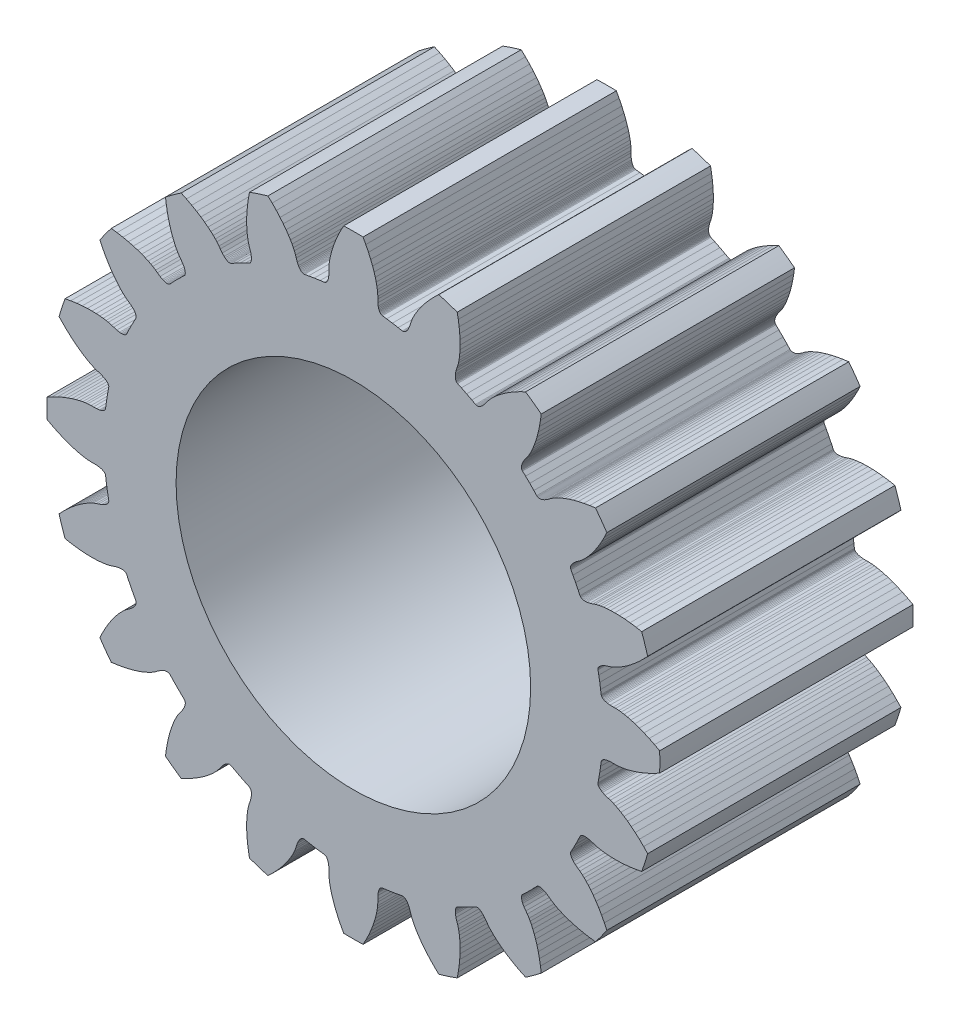
from build123d import *

# Parameters (mm, degrees)
MODEL_R             = 7
BOSS_EXTRUDE1_DEPTH = 10


with BuildPart() as part:
    # Model → Boss-Extrude1 (new body)
    with BuildSketch(Plane.XY):
        with BuildLine():
            Line((11.2915235, 3.0418739), (11.4619079, 3.2073958))
            Line((11.4619079, 3.2073958), (11.620070425, 3.373952203))
            ThreePointArc((11.620070425, 3.373952203), (11.507767436, 3.739100319), (11.383993824, 4.100521403))
            Line((11.383993824, 4.100521403), (11.1581382, 4.1423027))
            Line((11.1581382, 4.1423027), (10.923003, 4.1760633))
            Line((10.923003, 4.1760633), (10.7039175, 4.1982149))
            Line((10.7039175, 4.1982149), (10.502571, 4.2100898))
            Line((10.502571, 4.2100898), (10.3185985, 4.2132191))
            Line((10.3185985, 4.2132191), (10.1535493, 4.2091218))
            Line((10.1535493, 4.2091218), (10.0061288, 4.1992817))
            Line((10.0061288, 4.1992817), (9.8777646, 4.1853019))
            Line((9.8777646, 4.1853019), (9.7666137, 4.1684429))
            Line((9.7666137, 4.1684429), (9.676193, 4.1508334))
            Line((9.676193, 4.1508334), (9.5491158, 4.118138))
            Line((9.5491158, 4.118138), (9.462492, 4.0875699))
            Line((9.462492, 4.0875699), (9.3410531, 4.0503288))
            Line((9.3410531, 4.0503288), (9.2335928, 4.0297948))
            Line((9.2335928, 4.0297948), (9.1854733, 4.0254))
            Line((9.1854733, 4.0254), (9.1412703, 4.0247066))
            Line((9.1412703, 4.0247066), (9.1011235, 4.0275503))
            Line((9.1011235, 4.0275503), (9.0651686, 4.0337532))
            Line((9.0651686, 4.0337532), (9.0335098, 4.0431327))
            Line((9.0335098, 4.0431327), (9.0062735, 4.0555288))
            Line((9.0062735, 4.0555288), (8.9835686, 4.07075))
            Line((8.9835686, 4.07075), (8.9654902, 4.0886091))
            Line((8.9654902, 4.0886091), (8.9495613, 4.1143647))
            Line((8.9495613, 4.1143647), (8.8788891, 4.264785))
            Line((8.8788891, 4.264785), (8.7764143, 4.4718064))
            Line((8.7764143, 4.4718064), (8.6691636, 4.6763944))
            Line((8.6691636, 4.6763944), (8.5890111, 4.8219843))
            Line((8.5890111, 4.8219843), (8.5775372, 4.8500098))
            Line((8.5775372, 4.8500098), (8.573715, 4.8751328))
            Line((8.573715, 4.8751328), (8.5747465, 4.9024483))
            Line((8.5747465, 4.9024483), (8.5807269, 4.9317692))
            Line((8.5807269, 4.9317692), (8.5917473, 4.9628948))
            Line((8.5917473, 4.9628948), (8.6078628, 4.9956289))
            Line((8.6078628, 4.9956289), (8.6291599, 5.0297798))
            Line((8.6291599, 5.0297798), (8.6557027, 5.0651333))
            Line((8.6557027, 5.0651333), (8.6875421, 5.1014796))
            Line((8.6875421, 5.1014796), (8.767318, 5.1763472))
            Line((8.767318, 5.1763472), (8.8688268, 5.2527035))
            Line((8.8688268, 5.2527035), (8.9444731, 5.3048162))
            Line((8.9444731, 5.3048162), (9.0456183, 5.3884059))
            Line((9.0456183, 5.3884059), (9.1130126, 5.4512072))
            Line((9.1130126, 5.4512072), (9.1919847, 5.5312207))
            Line((9.1919847, 5.5312207), (9.2787452, 5.6268524))
            Line((9.2787452, 5.6268524), (9.3733576, 5.7403343))
            Line((9.3733576, 5.7403343), (9.4736858, 5.8714535))
            Line((9.4736858, 5.8714535), (9.5792905, 6.0221297))
            Line((9.5792905, 6.0221297), (9.688032, 6.1920024))
            Line((9.688032, 6.1920024), (9.7988862, 6.3822667))
            Line((9.7988862, 6.3822667), (9.9097824, 6.592339))
            Line((9.9097824, 6.592339), (10.008735211, 6.799618511))
            ThreePointArc((10.008735211, 6.799618511), (9.789091856, 7.112191578), (9.559690719, 7.417675202))
            Line((9.559690719, 7.417675202), (9.3319781, 7.3876183))
            Line((9.3319781, 7.3876183), (9.0979187, 7.3470657))
            Line((9.0979187, 7.3470657), (8.8827107, 7.300432))
            Line((8.8827107, 7.300432), (8.6875493, 7.2495062))
            Line((8.6875493, 7.2495062), (8.511614, 7.1956317))
            Line((8.511614, 7.1956317), (8.3559091, 7.140732))
            Line((8.3559091, 7.140732), (8.2187445, 7.0858181))
            Line((8.2187445, 7.0858181), (8.100983, 7.0328558))
            Line((8.100983, 7.0328558), (8.0004819, 6.9824744))
            Line((8.0004819, 6.9824744), (7.9199283, 6.9377853))
            Line((7.9199283, 6.9377853), (7.8091742, 6.8674211))
            Line((7.8091742, 6.8674211), (7.7362361, 6.8115808))
            Line((7.7362361, 6.8115808), (7.632249, 6.7386357))
            Line((7.632249, 6.7386357), (7.5363936, 6.6858997))
            Line((7.5363936, 6.6858997), (7.4919873, 6.6668502))
            Line((7.4919873, 6.6668502), (7.4501619, 6.6525313))
            Line((7.4501619, 6.6525313), (7.4111013, 6.6428298))
            Line((7.4111013, 6.6428298), (7.3749894, 6.6376184))
            Line((7.3749894, 6.6376184), (7.3419816, 6.6367558))
            Line((7.3419816, 6.6367558), (7.3122478, 6.6401287))
            Line((7.3122478, 6.6401287), (7.2859505, 6.6475886))
            Line((7.2859505, 6.6475886), (7.2632382, 6.6589872))
            Line((7.2632382, 6.6589872), (7.24013, 6.6785599))
            Line((7.24013, 6.6785599), (7.1264343, 6.7997792))
            Line((7.1264343, 6.7997792), (6.9650018, 6.9650018))
            Line((6.9650018, 6.9650018), (6.7997792, 7.1264343))
            Line((6.7997792, 7.1264343), (6.6785599, 7.24013))
            Line((6.6785599, 7.24013), (6.6589872, 7.2632382))
            Line((6.6589872, 7.2632382), (6.6475886, 7.2859505))
            Line((6.6475886, 7.2859505), (6.6401287, 7.3122478))
            Line((6.6401287, 7.3122478), (6.6367558, 7.3419816))
            Line((6.6367558, 7.3419816), (6.6376184, 7.3749894))
            Line((6.6376184, 7.3749894), (6.6428298, 7.4111013))
            Line((6.6428298, 7.4111013), (6.6525313, 7.4501619))
            Line((6.6525313, 7.4501619), (6.6668502, 7.4919873))
            Line((6.6668502, 7.4919873), (6.6858997, 7.5363936))
            Line((6.6858997, 7.5363936), (6.7386357, 7.632249))
            Line((6.7386357, 7.632249), (6.8115808, 7.7362361))
            Line((6.8115808, 7.7362361), (6.8674211, 7.8091742))
            Line((6.8674211, 7.8091742), (6.9377853, 7.9199283))
            Line((6.9377853, 7.9199283), (6.9824744, 8.0004819))
            Line((6.9824744, 8.0004819), (7.0328558, 8.100983))
            Line((7.0328558, 8.100983), (7.0858181, 8.2187445))
            Line((7.0858181, 8.2187445), (7.140732, 8.3559091))
            Line((7.140732, 8.3559091), (7.1956317, 8.511614))
            Line((7.1956317, 8.511614), (7.2495062, 8.6875493))
            Line((7.2495062, 8.6875493), (7.300432, 8.8827107))
            Line((7.300432, 8.8827107), (7.3470657, 9.0979187))
            Line((7.3470657, 9.0979187), (7.3876183, 9.3319781))
            Line((7.3876183, 9.3319781), (7.417675202, 9.559690719))
            ThreePointArc((7.417675202, 9.559690719), (7.112191666, 9.789091977), (6.799618511, 10.008735211))
            Line((6.799618511, 10.008735211), (6.592339, 9.9097824))
            Line((6.592339, 9.9097824), (6.3822667, 9.7988862))
            Line((6.3822667, 9.7988862), (6.1920024, 9.688032))
            Line((6.1920024, 9.688032), (6.0221297, 9.5792905))
            Line((6.0221297, 9.5792905), (5.8714535, 9.4736858))
            Line((5.8714535, 9.4736858), (5.7403343, 9.3733576))
            Line((5.7403343, 9.3733576), (5.6268524, 9.2787452))
            Line((5.6268524, 9.2787452), (5.5312207, 9.1919847))
            Line((5.5312207, 9.1919847), (5.4512072, 9.1130126))
            Line((5.4512072, 9.1130126), (5.3884059, 9.0456183))
            Line((5.3884059, 9.0456183), (5.3048162, 8.9444731))
            Line((5.3048162, 8.9444731), (5.2527035, 8.8688268))
            Line((5.2527035, 8.8688268), (5.1763472, 8.767318))
            Line((5.1763472, 8.767318), (5.1014796, 8.6875421))
            Line((5.1014796, 8.6875421), (5.0651333, 8.6557027))
            Line((5.0651333, 8.6557027), (5.0297798, 8.6291599))
            Line((5.0297798, 8.6291599), (4.9956289, 8.6078628))
            Line((4.9956289, 8.6078628), (4.9628948, 8.5917473))
            Line((4.9628948, 8.5917473), (4.9317692, 8.5807269))
            Line((4.9317692, 8.5807269), (4.9024483, 8.5747465))
            Line((4.9024483, 8.5747465), (4.8751328, 8.573715))
            Line((4.8751328, 8.573715), (4.8500098, 8.5775372))
            Line((4.8500098, 8.5775372), (4.8219843, 8.5890111))
            Line((4.8219843, 8.5890111), (4.6763944, 8.6691636))
            Line((4.6763944, 8.6691636), (4.4718064, 8.7764143))
            Line((4.4718064, 8.7764143), (4.264785, 8.8788891))
            Line((4.264785, 8.8788891), (4.1143647, 8.9495613))
            Line((4.1143647, 8.9495613), (4.0886091, 8.9654902))
            Line((4.0886091, 8.9654902), (4.07075, 8.9835686))
            Line((4.07075, 8.9835686), (4.0555288, 9.0062735))
            Line((4.0555288, 9.0062735), (4.0431327, 9.0335098))
            Line((4.0431327, 9.0335098), (4.0337532, 9.0651686))
            Line((4.0337532, 9.0651686), (4.0275503, 9.1011235))
            Line((4.0275503, 9.1011235), (4.0247066, 9.1412703))
            Line((4.0247066, 9.1412703), (4.0254, 9.1854733))
            Line((4.0254, 9.1854733), (4.0297948, 9.2335928))
            Line((4.0297948, 9.2335928), (4.0503288, 9.3410531))
            Line((4.0503288, 9.3410531), (4.0875699, 9.462492))
            Line((4.0875699, 9.462492), (4.118138, 9.5491158))
            Line((4.118138, 9.5491158), (4.1508334, 9.676193))
            Line((4.1508334, 9.676193), (4.1684429, 9.7666137))
            Line((4.1684429, 9.7666137), (4.1853019, 9.8777646))
            Line((4.1853019, 9.8777646), (4.1992817, 10.0061288))
            Line((4.1992817, 10.0061288), (4.2091218, 10.1535493))
            Line((4.2091218, 10.1535493), (4.2132191, 10.3185985))
            Line((4.2132191, 10.3185985), (4.2100898, 10.502571))
            Line((4.2100898, 10.502571), (4.1982149, 10.7039175))
            Line((4.1982149, 10.7039175), (4.1760633, 10.923003))
            Line((4.1760633, 10.923003), (4.1423027, 11.1581382))
            Line((4.1423027, 11.1581382), (4.100521403, 11.383993924))
            ThreePointArc((4.100521403, 11.383993924), (3.739100375, 11.507767709), (3.373952203, 11.620070525))
            Line((3.373952203, 11.620070525), (3.2073958, 11.4619079))
            Line((3.2073958, 11.4619079), (3.0418739, 11.2915235))
            Line((3.0418739, 11.2915235), (2.8951777, 11.1273))
            Line((2.8951777, 11.1273), (2.7672222, 10.9713871))
            Line((2.7672222, 10.9713871), (2.6565542, 10.8243896))
            Line((2.6565542, 10.8243896), (2.5628555, 10.6884537))
            Line((2.5628555, 10.6884537), (2.4841647, 10.5634041))
            Line((2.4841647, 10.5634041), (2.420024, 10.4513382))
            Line((2.420024, 10.4513382), (2.3683303, 10.3515057))
            Line((2.3683303, 10.3515057), (2.3294287, 10.2680032))
            Line((2.3294287, 10.2680032), (2.2811858, 10.1459777))
            Line((2.2811858, 10.1459777), (2.2549997, 10.0579301))
            Line((2.2549997, 10.0579301), (2.2137484, 9.9377942))
            Line((2.2137484, 9.9377942), (2.1671972, 9.8387875))
            Line((2.1671972, 9.8387875), (2.1424688, 9.7972748))
            Line((2.1424688, 9.7972748), (2.1170478, 9.7611062))
            Line((2.1170478, 9.7611062), (2.0911495, 9.7302983))
            Line((2.0911495, 9.7302983), (2.0649975, 9.7048561))
            Line((2.0649975, 9.7048561), (2.0388008, 9.6847567))
            Line((2.0388008, 9.6847567), (2.012763, 9.6700083))
            Line((2.012763, 9.6700083), (1.9871032, 9.6605864))
            Line((1.9871032, 9.6605864), (1.9620287, 9.6564581))
            Line((1.9620287, 9.6564581), (1.9318292, 9.6587101))
            Line((1.9318292, 9.6587101), (1.7685965, 9.6899499))
            Line((1.7685965, 9.6899499), (1.5408795, 9.7287302))
            Line((1.5408795, 9.7287302), (1.312324, 9.7622164))
            Line((1.312324, 9.7622164), (1.1474268, 9.7829472))
            Line((1.1474268, 9.7829472), (1.1180095, 9.7901376))
            Line((1.1180095, 9.7901376), (1.0954379, 9.8018123))
            Line((1.0954379, 9.8018123), (1.0739455, 9.8187024))
            Line((1.0739455, 9.8187024), (1.0537397, 9.8407751))
            Line((1.0537397, 9.8407751), (1.0350361, 9.867986))
            Line((1.0350361, 9.867986), (1.0180261, 9.9002643))
            Line((1.0180261, 9.9002643), (1.0029156, 9.9375674))
            Line((1.0029156, 9.9375674), (0.9899155, 9.9798213))
            Line((0.9899155, 9.9798213), (0.9792255, 10.0269437))
            Line((0.9792255, 10.0269437), (0.9655474, 10.1354898))
            Line((0.9655474, 10.1354898), (0.9634392, 10.2624932))
            Line((0.9634392, 10.2624932), (0.9657429, 10.3543234))
            Line((0.9657429, 10.3543234), (0.9575691, 10.4852844))
            Line((0.9575691, 10.4852844), (0.9463752, 10.5767213))
            Line((0.9463752, 10.5767213), (0.9280615, 10.6876418))
            Line((0.9280615, 10.6876418), (0.9016904, 10.8140434))
            Line((0.9016904, 10.8140434), (0.8654934, 10.9572894))
            Line((0.8654934, 10.9572894), (0.8183872, 11.1155266))
            Line((0.8183872, 11.1155266), (0.7585604, 11.2895278))
            Line((0.7585604, 11.2895278), (0.6850472, 11.4773502))
            Line((0.6850472, 11.4773502), (0.5962786, 11.6788677))
            Line((0.5962786, 11.6788677), (0.4915097, 11.892062))
            Line((0.4915097, 11.892062), (0.381980101, 12.093952308))
            ThreePointArc((0.381980101, 12.093952308), (5.3e-08, 12.0999831), (-0.381979995, 12.093952311))
            Line((-0.381979995, 12.093952311), (-0.4915097, 11.892062))
            Line((-0.4915097, 11.892062), (-0.5962786, 11.6788677))
            Line((-0.5962786, 11.6788677), (-0.6850472, 11.4773502))
            Line((-0.6850472, 11.4773502), (-0.7585604, 11.2895278))
            Line((-0.7585604, 11.2895278), (-0.8183872, 11.1155266))
            Line((-0.8183872, 11.1155266), (-0.8654934, 10.9572894))
            Line((-0.8654934, 10.9572894), (-0.9016904, 10.8140434))
            Line((-0.9016904, 10.8140434), (-0.9280615, 10.6876418))
            Line((-0.9280615, 10.6876418), (-0.9463752, 10.5767213))
            Line((-0.9463752, 10.5767213), (-0.9575691, 10.4852844))
            Line((-0.9575691, 10.4852844), (-0.9657429, 10.3543234))
            Line((-0.9657429, 10.3543234), (-0.9634392, 10.2624932))
            Line((-0.9634392, 10.2624932), (-0.9655474, 10.1354898))
            Line((-0.9655474, 10.1354898), (-0.9792255, 10.0269437))
            Line((-0.9792255, 10.0269437), (-0.9899155, 9.9798213))
            Line((-0.9899155, 9.9798213), (-1.0029156, 9.9375674))
            Line((-1.0029156, 9.9375674), (-1.0180261, 9.9002643))
            Line((-1.0180261, 9.9002643), (-1.0350361, 9.867986))
            Line((-1.0350361, 9.867986), (-1.0537397, 9.8407751))
            Line((-1.0537397, 9.8407751), (-1.0739455, 9.8187024))
            Line((-1.0739455, 9.8187024), (-1.0954379, 9.8018123))
            Line((-1.0954379, 9.8018123), (-1.1180095, 9.7901376))
            Line((-1.1180095, 9.7901376), (-1.1474268, 9.7829472))
            Line((-1.1474268, 9.7829472), (-1.312324, 9.7622164))
            Line((-1.312324, 9.7622164), (-1.5408795, 9.7287302))
            Line((-1.5408795, 9.7287302), (-1.7685965, 9.6899499))
            Line((-1.7685965, 9.6899499), (-1.9318292, 9.6587101))
            Line((-1.9318292, 9.6587101), (-1.9620287, 9.6564581))
            Line((-1.9620287, 9.6564581), (-1.9871032, 9.6605864))
            Line((-1.9871032, 9.6605864), (-2.012763, 9.6700083))
            Line((-2.012763, 9.6700083), (-2.0388008, 9.6847567))
            Line((-2.0388008, 9.6847567), (-2.0649975, 9.7048561))
            Line((-2.0649975, 9.7048561), (-2.0911495, 9.7302983))
            Line((-2.0911495, 9.7302983), (-2.1170478, 9.7611062))
            Line((-2.1170478, 9.7611062), (-2.1424688, 9.7972748))
            Line((-2.1424688, 9.7972748), (-2.1671972, 9.8387875))
            Line((-2.1671972, 9.8387875), (-2.2137484, 9.9377942))
            Line((-2.2137484, 9.9377942), (-2.2549997, 10.0579301))
            Line((-2.2549997, 10.0579301), (-2.2811858, 10.1459777))
            Line((-2.2811858, 10.1459777), (-2.3294287, 10.2680032))
            Line((-2.3294287, 10.2680032), (-2.3683303, 10.3515057))
            Line((-2.3683303, 10.3515057), (-2.420024, 10.4513382))
            Line((-2.420024, 10.4513382), (-2.4841647, 10.5634041))
            Line((-2.4841647, 10.5634041), (-2.5628555, 10.6884537))
            Line((-2.5628555, 10.6884537), (-2.6565542, 10.8243896))
            Line((-2.6565542, 10.8243896), (-2.7672222, 10.9713871))
            Line((-2.7672222, 10.9713871), (-2.8951777, 11.1273))
            Line((-2.8951777, 11.1273), (-3.0418739, 11.2915235))
            Line((-3.0418739, 11.2915235), (-3.2073958, 11.4619079))
            Line((-3.2073958, 11.4619079), (-3.373952203, 11.620070425))
            ThreePointArc((-3.373952203, 11.620070425), (-3.739100319, 11.507767436), (-4.100521403, 11.383993824))
            Line((-4.100521403, 11.383993824), (-4.1423027, 11.1581382))
            Line((-4.1423027, 11.1581382), (-4.1760633, 10.923003))
            Line((-4.1760633, 10.923003), (-4.1982149, 10.7039175))
            Line((-4.1982149, 10.7039175), (-4.2100898, 10.502571))
            Line((-4.2100898, 10.502571), (-4.2132191, 10.3185985))
            Line((-4.2132191, 10.3185985), (-4.2091218, 10.1535493))
            Line((-4.2091218, 10.1535493), (-4.1992817, 10.0061288))
            Line((-4.1992817, 10.0061288), (-4.1853019, 9.8777646))
            Line((-4.1853019, 9.8777646), (-4.1684429, 9.7666137))
            Line((-4.1684429, 9.7666137), (-4.1508334, 9.676193))
            Line((-4.1508334, 9.676193), (-4.118138, 9.5491158))
            Line((-4.118138, 9.5491158), (-4.0875699, 9.462492))
            Line((-4.0875699, 9.462492), (-4.0503288, 9.3410531))
            Line((-4.0503288, 9.3410531), (-4.0297948, 9.2335928))
            Line((-4.0297948, 9.2335928), (-4.0254, 9.1854733))
            Line((-4.0254, 9.1854733), (-4.0247066, 9.1412703))
            Line((-4.0247066, 9.1412703), (-4.0275503, 9.1011235))
            Line((-4.0275503, 9.1011235), (-4.0337532, 9.0651686))
            Line((-4.0337532, 9.0651686), (-4.0431327, 9.0335098))
            Line((-4.0431327, 9.0335098), (-4.0555288, 9.0062735))
            Line((-4.0555288, 9.0062735), (-4.07075, 8.9835686))
            Line((-4.07075, 8.9835686), (-4.0886091, 8.9654902))
            Line((-4.0886091, 8.9654902), (-4.1143647, 8.9495613))
            Line((-4.1143647, 8.9495613), (-4.264785, 8.8788891))
            Line((-4.264785, 8.8788891), (-4.4718064, 8.7764143))
            Line((-4.4718064, 8.7764143), (-4.6763944, 8.6691636))
            Line((-4.6763944, 8.6691636), (-4.8219843, 8.5890111))
            Line((-4.8219843, 8.5890111), (-4.8500098, 8.5775372))
            Line((-4.8500098, 8.5775372), (-4.8751328, 8.573715))
            Line((-4.8751328, 8.573715), (-4.9024483, 8.5747465))
            Line((-4.9024483, 8.5747465), (-4.9317692, 8.5807269))
            Line((-4.9317692, 8.5807269), (-4.9628948, 8.5917473))
            Line((-4.9628948, 8.5917473), (-4.9956289, 8.6078628))
            Line((-4.9956289, 8.6078628), (-5.0297798, 8.6291599))
            Line((-5.0297798, 8.6291599), (-5.0651333, 8.6557027))
            Line((-5.0651333, 8.6557027), (-5.1014796, 8.6875421))
            Line((-5.1014796, 8.6875421), (-5.1763472, 8.767318))
            Line((-5.1763472, 8.767318), (-5.2527035, 8.8688268))
            Line((-5.2527035, 8.8688268), (-5.3048162, 8.9444731))
            Line((-5.3048162, 8.9444731), (-5.3884059, 9.0456183))
            Line((-5.3884059, 9.0456183), (-5.4512072, 9.1130126))
            Line((-5.4512072, 9.1130126), (-5.5312207, 9.1919847))
            Line((-5.5312207, 9.1919847), (-5.6268524, 9.2787452))
            Line((-5.6268524, 9.2787452), (-5.7403343, 9.3733576))
            Line((-5.7403343, 9.3733576), (-5.8714535, 9.4736858))
            Line((-5.8714535, 9.4736858), (-6.0221297, 9.5792905))
            Line((-6.0221297, 9.5792905), (-6.1920024, 9.688032))
            Line((-6.1920024, 9.688032), (-6.3822667, 9.7988862))
            Line((-6.3822667, 9.7988862), (-6.592339, 9.9097824))
            Line((-6.592339, 9.9097824), (-6.799618511, 10.008735211))
            ThreePointArc((-6.799618511, 10.008735211), (-7.112191578, 9.789091856), (-7.417675202, 9.559690719))
            Line((-7.417675202, 9.559690719), (-7.3876183, 9.3319781))
            Line((-7.3876183, 9.3319781), (-7.3470657, 9.0979187))
            Line((-7.3470657, 9.0979187), (-7.300432, 8.8827107))
            Line((-7.300432, 8.8827107), (-7.2495062, 8.6875493))
            Line((-7.2495062, 8.6875493), (-7.1956317, 8.511614))
            Line((-7.1956317, 8.511614), (-7.140732, 8.3559091))
            Line((-7.140732, 8.3559091), (-7.0858181, 8.2187445))
            Line((-7.0858181, 8.2187445), (-7.0328558, 8.100983))
            Line((-7.0328558, 8.100983), (-6.9824744, 8.0004819))
            Line((-6.9824744, 8.0004819), (-6.9377853, 7.9199283))
            Line((-6.9377853, 7.9199283), (-6.8674211, 7.8091742))
            Line((-6.8674211, 7.8091742), (-6.8115808, 7.7362361))
            Line((-6.8115808, 7.7362361), (-6.7386357, 7.632249))
            Line((-6.7386357, 7.632249), (-6.6858997, 7.5363936))
            Line((-6.6858997, 7.5363936), (-6.6668502, 7.4919873))
            Line((-6.6668502, 7.4919873), (-6.6525313, 7.4501619))
            Line((-6.6525313, 7.4501619), (-6.6428298, 7.4111013))
            Line((-6.6428298, 7.4111013), (-6.6376184, 7.3749894))
            Line((-6.6376184, 7.3749894), (-6.6367558, 7.3419816))
            Line((-6.6367558, 7.3419816), (-6.6401287, 7.3122478))
            Line((-6.6401287, 7.3122478), (-6.6475886, 7.2859505))
            Line((-6.6475886, 7.2859505), (-6.6589872, 7.2632382))
            Line((-6.6589872, 7.2632382), (-6.6785599, 7.24013))
            Line((-6.6785599, 7.24013), (-6.7997792, 7.1264343))
            Line((-6.7997792, 7.1264343), (-6.9650018, 6.9650018))
            Line((-6.9650018, 6.9650018), (-7.1264343, 6.7997792))
            Line((-7.1264343, 6.7997792), (-7.24013, 6.6785599))
            Line((-7.24013, 6.6785599), (-7.2632382, 6.6589872))
            Line((-7.2632382, 6.6589872), (-7.2859505, 6.6475886))
            Line((-7.2859505, 6.6475886), (-7.3122478, 6.6401287))
            Line((-7.3122478, 6.6401287), (-7.3419816, 6.6367558))
            Line((-7.3419816, 6.6367558), (-7.3749894, 6.6376184))
            Line((-7.3749894, 6.6376184), (-7.4111013, 6.6428298))
            Line((-7.4111013, 6.6428298), (-7.4501619, 6.6525313))
            Line((-7.4501619, 6.6525313), (-7.4919873, 6.6668502))
            Line((-7.4919873, 6.6668502), (-7.5363936, 6.6858997))
            Line((-7.5363936, 6.6858997), (-7.632249, 6.7386357))
            Line((-7.632249, 6.7386357), (-7.7362361, 6.8115808))
            Line((-7.7362361, 6.8115808), (-7.8091742, 6.8674211))
            Line((-7.8091742, 6.8674211), (-7.9199283, 6.9377853))
            Line((-7.9199283, 6.9377853), (-8.0004819, 6.9824744))
            Line((-8.0004819, 6.9824744), (-8.100983, 7.0328558))
            Line((-8.100983, 7.0328558), (-8.2187445, 7.0858181))
            Line((-8.2187445, 7.0858181), (-8.3559091, 7.140732))
            Line((-8.3559091, 7.140732), (-8.511614, 7.1956317))
            Line((-8.511614, 7.1956317), (-8.6875493, 7.2495062))
            Line((-8.6875493, 7.2495062), (-8.8827107, 7.300432))
            Line((-8.8827107, 7.300432), (-9.0979187, 7.3470657))
            Line((-9.0979187, 7.3470657), (-9.3319781, 7.3876183))
            Line((-9.3319781, 7.3876183), (-9.559690719, 7.417675202))
            ThreePointArc((-9.559690719, 7.417675202), (-9.789091977, 7.112191666), (-10.008735211, 6.799618511))
            Line((-10.008735211, 6.799618511), (-9.9097824, 6.592339))
            Line((-9.9097824, 6.592339), (-9.7988862, 6.3822667))
            Line((-9.7988862, 6.3822667), (-9.688032, 6.1920024))
            Line((-9.688032, 6.1920024), (-9.5792905, 6.0221297))
            Line((-9.5792905, 6.0221297), (-9.4736858, 5.8714535))
            Line((-9.4736858, 5.8714535), (-9.3733576, 5.7403343))
            Line((-9.3733576, 5.7403343), (-9.2787452, 5.6268524))
            Line((-9.2787452, 5.6268524), (-9.1919847, 5.5312207))
            Line((-9.1919847, 5.5312207), (-9.1130126, 5.4512072))
            Line((-9.1130126, 5.4512072), (-9.0456183, 5.3884059))
            Line((-9.0456183, 5.3884059), (-8.9444731, 5.3048162))
            Line((-8.9444731, 5.3048162), (-8.8688268, 5.2527035))
            Line((-8.8688268, 5.2527035), (-8.767318, 5.1763472))
            Line((-8.767318, 5.1763472), (-8.6875421, 5.1014796))
            Line((-8.6875421, 5.1014796), (-8.6557027, 5.0651333))
            Line((-8.6557027, 5.0651333), (-8.6291599, 5.0297798))
            Line((-8.6291599, 5.0297798), (-8.6078628, 4.9956289))
            Line((-8.6078628, 4.9956289), (-8.5917473, 4.9628948))
            Line((-8.5917473, 4.9628948), (-8.5807269, 4.9317692))
            Line((-8.5807269, 4.9317692), (-8.5747465, 4.9024483))
            Line((-8.5747465, 4.9024483), (-8.573715, 4.8751328))
            Line((-8.573715, 4.8751328), (-8.5775372, 4.8500098))
            Line((-8.5775372, 4.8500098), (-8.5890111, 4.8219843))
            Line((-8.5890111, 4.8219843), (-8.6691636, 4.6763944))
            Line((-8.6691636, 4.6763944), (-8.7764143, 4.4718064))
            Line((-8.7764143, 4.4718064), (-8.8788891, 4.264785))
            Line((-8.8788891, 4.264785), (-8.9495613, 4.1143647))
            Line((-8.9495613, 4.1143647), (-8.9654902, 4.0886091))
            Line((-8.9654902, 4.0886091), (-8.9835686, 4.07075))
            Line((-8.9835686, 4.07075), (-9.0062735, 4.0555288))
            Line((-9.0062735, 4.0555288), (-9.0335098, 4.0431327))
            Line((-9.0335098, 4.0431327), (-9.0651686, 4.0337532))
            Line((-9.0651686, 4.0337532), (-9.1011235, 4.0275503))
            Line((-9.1011235, 4.0275503), (-9.1412703, 4.0247066))
            Line((-9.1412703, 4.0247066), (-9.1854733, 4.0254))
            Line((-9.1854733, 4.0254), (-9.2335928, 4.0297948))
            Line((-9.2335928, 4.0297948), (-9.3410531, 4.0503288))
            Line((-9.3410531, 4.0503288), (-9.462492, 4.0875699))
            Line((-9.462492, 4.0875699), (-9.5491158, 4.118138))
            Line((-9.5491158, 4.118138), (-9.676193, 4.1508334))
            Line((-9.676193, 4.1508334), (-9.7666137, 4.1684429))
            Line((-9.7666137, 4.1684429), (-9.8777646, 4.1853019))
            Line((-9.8777646, 4.1853019), (-10.0061288, 4.1992817))
            Line((-10.0061288, 4.1992817), (-10.1535493, 4.2091218))
            Line((-10.1535493, 4.2091218), (-10.3185985, 4.2132191))
            Line((-10.3185985, 4.2132191), (-10.502571, 4.2100898))
            Line((-10.502571, 4.2100898), (-10.7039175, 4.1982149))
            Line((-10.7039175, 4.1982149), (-10.923003, 4.1760633))
            Line((-10.923003, 4.1760633), (-11.1581382, 4.1423027))
            Line((-11.1581382, 4.1423027), (-11.383993924, 4.100521403))
            ThreePointArc((-11.383993924, 4.100521403), (-11.507767706, 3.739100374), (-11.620070525, 3.373952203))
            Line((-11.620070525, 3.373952203), (-11.4619079, 3.2073958))
            Line((-11.4619079, 3.2073958), (-11.2915235, 3.0418739))
            Line((-11.2915235, 3.0418739), (-11.1273, 2.8951777))
            Line((-11.1273, 2.8951777), (-10.9713871, 2.7672222))
            Line((-10.9713871, 2.7672222), (-10.8243896, 2.6565542))
            Line((-10.8243896, 2.6565542), (-10.6884537, 2.5628555))
            Line((-10.6884537, 2.5628555), (-10.5634041, 2.4841647))
            Line((-10.5634041, 2.4841647), (-10.4513382, 2.420024))
            Line((-10.4513382, 2.420024), (-10.3515057, 2.3683303))
            Line((-10.3515057, 2.3683303), (-10.2680032, 2.3294287))
            Line((-10.2680032, 2.3294287), (-10.1459777, 2.2811858))
            Line((-10.1459777, 2.2811858), (-10.0579301, 2.2549997))
            Line((-10.0579301, 2.2549997), (-9.9377942, 2.2137484))
            Line((-9.9377942, 2.2137484), (-9.8387875, 2.1671972))
            Line((-9.8387875, 2.1671972), (-9.7972748, 2.1424688))
            Line((-9.7972748, 2.1424688), (-9.7611062, 2.1170478))
            Line((-9.7611062, 2.1170478), (-9.7302983, 2.0911495))
            Line((-9.7302983, 2.0911495), (-9.7048561, 2.0649975))
            Line((-9.7048561, 2.0649975), (-9.6847567, 2.0388008))
            Line((-9.6847567, 2.0388008), (-9.6700083, 2.012763))
            Line((-9.6700083, 2.012763), (-9.6605864, 1.9871032))
            Line((-9.6605864, 1.9871032), (-9.6564581, 1.9620287))
            Line((-9.6564581, 1.9620287), (-9.6587101, 1.9318292))
            Line((-9.6587101, 1.9318292), (-9.6899499, 1.7685965))
            Line((-9.6899499, 1.7685965), (-9.7287302, 1.5408795))
            Line((-9.7287302, 1.5408795), (-9.7622164, 1.312324))
            Line((-9.7622164, 1.312324), (-9.7829472, 1.1474268))
            Line((-9.7829472, 1.1474268), (-9.7901376, 1.1180095))
            Line((-9.7901376, 1.1180095), (-9.8018123, 1.0954379))
            Line((-9.8018123, 1.0954379), (-9.8187024, 1.0739455))
            Line((-9.8187024, 1.0739455), (-9.8407751, 1.0537397))
            Line((-9.8407751, 1.0537397), (-9.867986, 1.0350361))
            Line((-9.867986, 1.0350361), (-9.9002643, 1.0180261))
            Line((-9.9002643, 1.0180261), (-9.9375674, 1.0029156))
            Line((-9.9375674, 1.0029156), (-9.9798213, 0.9899155))
            Line((-9.9798213, 0.9899155), (-10.0269437, 0.9792255))
            Line((-10.0269437, 0.9792255), (-10.1354898, 0.9655474))
            Line((-10.1354898, 0.9655474), (-10.2624932, 0.9634392))
            Line((-10.2624932, 0.9634392), (-10.3543234, 0.9657429))
            Line((-10.3543234, 0.9657429), (-10.4852844, 0.9575691))
            Line((-10.4852844, 0.9575691), (-10.5767213, 0.9463752))
            Line((-10.5767213, 0.9463752), (-10.6876418, 0.9280615))
            Line((-10.6876418, 0.9280615), (-10.8140434, 0.9016904))
            Line((-10.8140434, 0.9016904), (-10.9572894, 0.8654934))
            Line((-10.9572894, 0.8654934), (-11.1155266, 0.8183872))
            Line((-11.1155266, 0.8183872), (-11.2895278, 0.7585604))
            Line((-11.2895278, 0.7585604), (-11.4773502, 0.6850472))
            Line((-11.4773502, 0.6850472), (-11.6788677, 0.5962786))
            Line((-11.6788677, 0.5962786), (-11.892062, 0.4915097))
            Line((-11.892062, 0.4915097), (-12.093952311, 0.381980095))
            ThreePointArc((-12.093952311, 0.381980095), (-12.0999831, 4.7e-08), (-12.093952308, -0.381980001))
            Line((-12.093952308, -0.381980001), (-11.892062, -0.4915097))
            Line((-11.892062, -0.4915097), (-11.6788677, -0.5962786))
            Line((-11.6788677, -0.5962786), (-11.4773502, -0.6850472))
            Line((-11.4773502, -0.6850472), (-11.2895278, -0.7585604))
            Line((-11.2895278, -0.7585604), (-11.1155266, -0.8183872))
            Line((-11.1155266, -0.8183872), (-10.9572894, -0.8654934))
            Line((-10.9572894, -0.8654934), (-10.8140434, -0.9016904))
            Line((-10.8140434, -0.9016904), (-10.6876418, -0.9280615))
            Line((-10.6876418, -0.9280615), (-10.5767213, -0.9463752))
            Line((-10.5767213, -0.9463752), (-10.4852844, -0.9575691))
            Line((-10.4852844, -0.9575691), (-10.3543234, -0.9657429))
            Line((-10.3543234, -0.9657429), (-10.2624932, -0.9634392))
            Line((-10.2624932, -0.9634392), (-10.1354898, -0.9655474))
            Line((-10.1354898, -0.9655474), (-10.0269437, -0.9792255))
            Line((-10.0269437, -0.9792255), (-9.9798213, -0.9899155))
            Line((-9.9798213, -0.9899155), (-9.9375674, -1.0029156))
            Line((-9.9375674, -1.0029156), (-9.9002643, -1.0180261))
            Line((-9.9002643, -1.0180261), (-9.867986, -1.0350361))
            Line((-9.867986, -1.0350361), (-9.8407751, -1.0537397))
            Line((-9.8407751, -1.0537397), (-9.8187024, -1.0739455))
            Line((-9.8187024, -1.0739455), (-9.8018123, -1.0954379))
            Line((-9.8018123, -1.0954379), (-9.7901376, -1.1180095))
            Line((-9.7901376, -1.1180095), (-9.7829472, -1.1474268))
            Line((-9.7829472, -1.1474268), (-9.7622164, -1.312324))
            Line((-9.7622164, -1.312324), (-9.7287302, -1.5408795))
            Line((-9.7287302, -1.5408795), (-9.6899499, -1.7685965))
            Line((-9.6899499, -1.7685965), (-9.6587101, -1.9318292))
            Line((-9.6587101, -1.9318292), (-9.6564581, -1.9620287))
            Line((-9.6564581, -1.9620287), (-9.6605864, -1.9871032))
            Line((-9.6605864, -1.9871032), (-9.6700083, -2.012763))
            Line((-9.6700083, -2.012763), (-9.6847567, -2.0388008))
            Line((-9.6847567, -2.0388008), (-9.7048561, -2.0649975))
            Line((-9.7048561, -2.0649975), (-9.7302983, -2.0911495))
            Line((-9.7302983, -2.0911495), (-9.7611062, -2.1170478))
            Line((-9.7611062, -2.1170478), (-9.7972748, -2.1424688))
            Line((-9.7972748, -2.1424688), (-9.8387875, -2.1671972))
            Line((-9.8387875, -2.1671972), (-9.9377942, -2.2137484))
            Line((-9.9377942, -2.2137484), (-10.0579301, -2.2549997))
            Line((-10.0579301, -2.2549997), (-10.1459777, -2.2811858))
            Line((-10.1459777, -2.2811858), (-10.2680032, -2.3294287))
            Line((-10.2680032, -2.3294287), (-10.3515057, -2.3683303))
            Line((-10.3515057, -2.3683303), (-10.4513382, -2.420024))
            Line((-10.4513382, -2.420024), (-10.5634041, -2.4841647))
            Line((-10.5634041, -2.4841647), (-10.6884537, -2.5628555))
            Line((-10.6884537, -2.5628555), (-10.8243896, -2.6565542))
            Line((-10.8243896, -2.6565542), (-10.9713871, -2.7672222))
            Line((-10.9713871, -2.7672222), (-11.1273, -2.8951777))
            Line((-11.1273, -2.8951777), (-11.2915235, -3.0418739))
            Line((-11.2915235, -3.0418739), (-11.4619079, -3.2073958))
            Line((-11.4619079, -3.2073958), (-11.620070425, -3.373952203))
            ThreePointArc((-11.620070425, -3.373952203), (-11.507767436, -3.739100319), (-11.383993824, -4.100521403))
            Line((-11.383993824, -4.100521403), (-11.1581382, -4.1423027))
            Line((-11.1581382, -4.1423027), (-10.923003, -4.1760633))
            Line((-10.923003, -4.1760633), (-10.7039175, -4.1982149))
            Line((-10.7039175, -4.1982149), (-10.502571, -4.2100898))
            Line((-10.502571, -4.2100898), (-10.3185985, -4.2132191))
            Line((-10.3185985, -4.2132191), (-10.1535493, -4.2091218))
            Line((-10.1535493, -4.2091218), (-10.0061288, -4.1992817))
            Line((-10.0061288, -4.1992817), (-9.8777646, -4.1853019))
            Line((-9.8777646, -4.1853019), (-9.7666137, -4.1684429))
            Line((-9.7666137, -4.1684429), (-9.676193, -4.1508334))
            Line((-9.676193, -4.1508334), (-9.5491158, -4.118138))
            Line((-9.5491158, -4.118138), (-9.462492, -4.0875699))
            Line((-9.462492, -4.0875699), (-9.3410531, -4.0503288))
            Line((-9.3410531, -4.0503288), (-9.2335928, -4.0297948))
            Line((-9.2335928, -4.0297948), (-9.1854733, -4.0254))
            Line((-9.1854733, -4.0254), (-9.1412703, -4.0247066))
            Line((-9.1412703, -4.0247066), (-9.1011235, -4.0275503))
            Line((-9.1011235, -4.0275503), (-9.0651686, -4.0337532))
            Line((-9.0651686, -4.0337532), (-9.0335098, -4.0431327))
            Line((-9.0335098, -4.0431327), (-9.0062735, -4.0555288))
            Line((-9.0062735, -4.0555288), (-8.9835686, -4.07075))
            Line((-8.9835686, -4.07075), (-8.9654902, -4.0886091))
            Line((-8.9654902, -4.0886091), (-8.9495613, -4.1143647))
            Line((-8.9495613, -4.1143647), (-8.8788891, -4.264785))
            Line((-8.8788891, -4.264785), (-8.7764143, -4.4718064))
            Line((-8.7764143, -4.4718064), (-8.6691636, -4.6763944))
            Line((-8.6691636, -4.6763944), (-8.5890111, -4.8219843))
            Line((-8.5890111, -4.8219843), (-8.5775372, -4.8500098))
            Line((-8.5775372, -4.8500098), (-8.573715, -4.8751328))
            Line((-8.573715, -4.8751328), (-8.5747465, -4.9024483))
            Line((-8.5747465, -4.9024483), (-8.5807269, -4.9317692))
            Line((-8.5807269, -4.9317692), (-8.5917473, -4.9628948))
            Line((-8.5917473, -4.9628948), (-8.6078628, -4.9956289))
            Line((-8.6078628, -4.9956289), (-8.6291599, -5.0297798))
            Line((-8.6291599, -5.0297798), (-8.6557027, -5.0651333))
            Line((-8.6557027, -5.0651333), (-8.6875421, -5.1014796))
            Line((-8.6875421, -5.1014796), (-8.767318, -5.1763472))
            Line((-8.767318, -5.1763472), (-8.8688268, -5.2527035))
            Line((-8.8688268, -5.2527035), (-8.9444731, -5.3048162))
            Line((-8.9444731, -5.3048162), (-9.0456183, -5.3884059))
            Line((-9.0456183, -5.3884059), (-9.1130126, -5.4512072))
            Line((-9.1130126, -5.4512072), (-9.1919847, -5.5312207))
            Line((-9.1919847, -5.5312207), (-9.2787452, -5.6268524))
            Line((-9.2787452, -5.6268524), (-9.3733576, -5.7403343))
            Line((-9.3733576, -5.7403343), (-9.4736858, -5.8714535))
            Line((-9.4736858, -5.8714535), (-9.5792905, -6.0221297))
            Line((-9.5792905, -6.0221297), (-9.688032, -6.1920024))
            Line((-9.688032, -6.1920024), (-9.7988862, -6.3822667))
            Line((-9.7988862, -6.3822667), (-9.9097824, -6.592339))
            Line((-9.9097824, -6.592339), (-10.008735211, -6.799618511))
            ThreePointArc((-10.008735211, -6.799618511), (-9.789091856, -7.112191578), (-9.559690719, -7.417675202))
            Line((-9.559690719, -7.417675202), (-9.3319781, -7.3876183))
            Line((-9.3319781, -7.3876183), (-9.0979187, -7.3470657))
            Line((-9.0979187, -7.3470657), (-8.8827107, -7.300432))
            Line((-8.8827107, -7.300432), (-8.6875493, -7.2495062))
            Line((-8.6875493, -7.2495062), (-8.511614, -7.1956317))
            Line((-8.511614, -7.1956317), (-8.3559091, -7.140732))
            Line((-8.3559091, -7.140732), (-8.2187445, -7.0858181))
            Line((-8.2187445, -7.0858181), (-8.100983, -7.0328558))
            Line((-8.100983, -7.0328558), (-8.0004819, -6.9824744))
            Line((-8.0004819, -6.9824744), (-7.9199283, -6.9377853))
            Line((-7.9199283, -6.9377853), (-7.8091742, -6.8674211))
            Line((-7.8091742, -6.8674211), (-7.7362361, -6.8115808))
            Line((-7.7362361, -6.8115808), (-7.632249, -6.7386357))
            Line((-7.632249, -6.7386357), (-7.5363936, -6.6858997))
            Line((-7.5363936, -6.6858997), (-7.4919873, -6.6668502))
            Line((-7.4919873, -6.6668502), (-7.4501619, -6.6525313))
            Line((-7.4501619, -6.6525313), (-7.4111013, -6.6428298))
            Line((-7.4111013, -6.6428298), (-7.3749894, -6.6376184))
            Line((-7.3749894, -6.6376184), (-7.3419816, -6.6367558))
            Line((-7.3419816, -6.6367558), (-7.3122478, -6.6401287))
            Line((-7.3122478, -6.6401287), (-7.2859505, -6.6475886))
            Line((-7.2859505, -6.6475886), (-7.2632382, -6.6589872))
            Line((-7.2632382, -6.6589872), (-7.24013, -6.6785599))
            Line((-7.24013, -6.6785599), (-7.1264343, -6.7997792))
            Line((-7.1264343, -6.7997792), (-6.9650018, -6.9650018))
            Line((-6.9650018, -6.9650018), (-6.7997792, -7.1264343))
            Line((-6.7997792, -7.1264343), (-6.6785599, -7.24013))
            Line((-6.6785599, -7.24013), (-6.6589872, -7.2632382))
            Line((-6.6589872, -7.2632382), (-6.6475886, -7.2859505))
            Line((-6.6475886, -7.2859505), (-6.6401287, -7.3122478))
            Line((-6.6401287, -7.3122478), (-6.6367558, -7.3419816))
            Line((-6.6367558, -7.3419816), (-6.6376184, -7.3749894))
            Line((-6.6376184, -7.3749894), (-6.6428298, -7.4111013))
            Line((-6.6428298, -7.4111013), (-6.6525313, -7.4501619))
            Line((-6.6525313, -7.4501619), (-6.6668502, -7.4919873))
            Line((-6.6668502, -7.4919873), (-6.6858997, -7.5363936))
            Line((-6.6858997, -7.5363936), (-6.7386357, -7.632249))
            Line((-6.7386357, -7.632249), (-6.8115808, -7.7362361))
            Line((-6.8115808, -7.7362361), (-6.8674211, -7.8091742))
            Line((-6.8674211, -7.8091742), (-6.9377853, -7.9199283))
            Line((-6.9377853, -7.9199283), (-6.9824744, -8.0004819))
            Line((-6.9824744, -8.0004819), (-7.0328558, -8.100983))
            Line((-7.0328558, -8.100983), (-7.0858181, -8.2187445))
            Line((-7.0858181, -8.2187445), (-7.140732, -8.3559091))
            Line((-7.140732, -8.3559091), (-7.1956317, -8.511614))
            Line((-7.1956317, -8.511614), (-7.2495062, -8.6875493))
            Line((-7.2495062, -8.6875493), (-7.300432, -8.8827107))
            Line((-7.300432, -8.8827107), (-7.3470657, -9.0979187))
            Line((-7.3470657, -9.0979187), (-7.3876183, -9.3319781))
            Line((-7.3876183, -9.3319781), (-7.417675202, -9.559690719))
            ThreePointArc((-7.417675202, -9.559690719), (-7.112191666, -9.789091977), (-6.799618511, -10.008735211))
            Line((-6.799618511, -10.008735211), (-6.592339, -9.9097824))
            Line((-6.592339, -9.9097824), (-6.3822667, -9.7988862))
            Line((-6.3822667, -9.7988862), (-6.1920024, -9.688032))
            Line((-6.1920024, -9.688032), (-6.0221297, -9.5792905))
            Line((-6.0221297, -9.5792905), (-5.8714535, -9.4736858))
            Line((-5.8714535, -9.4736858), (-5.7403343, -9.3733576))
            Line((-5.7403343, -9.3733576), (-5.6268524, -9.2787452))
            Line((-5.6268524, -9.2787452), (-5.5312207, -9.1919847))
            Line((-5.5312207, -9.1919847), (-5.4512072, -9.1130126))
            Line((-5.4512072, -9.1130126), (-5.3884059, -9.0456183))
            Line((-5.3884059, -9.0456183), (-5.3048162, -8.9444731))
            Line((-5.3048162, -8.9444731), (-5.2527035, -8.8688268))
            Line((-5.2527035, -8.8688268), (-5.1763472, -8.767318))
            Line((-5.1763472, -8.767318), (-5.1014796, -8.6875421))
            Line((-5.1014796, -8.6875421), (-5.0651333, -8.6557027))
            Line((-5.0651333, -8.6557027), (-5.0297798, -8.6291599))
            Line((-5.0297798, -8.6291599), (-4.9956289, -8.6078628))
            Line((-4.9956289, -8.6078628), (-4.9628948, -8.5917473))
            Line((-4.9628948, -8.5917473), (-4.9317692, -8.5807269))
            Line((-4.9317692, -8.5807269), (-4.9024483, -8.5747465))
            Line((-4.9024483, -8.5747465), (-4.8751328, -8.573715))
            Line((-4.8751328, -8.573715), (-4.8500098, -8.5775372))
            Line((-4.8500098, -8.5775372), (-4.8219843, -8.5890111))
            Line((-4.8219843, -8.5890111), (-4.6763944, -8.6691636))
            Line((-4.6763944, -8.6691636), (-4.4718064, -8.7764143))
            Line((-4.4718064, -8.7764143), (-4.264785, -8.8788891))
            Line((-4.264785, -8.8788891), (-4.1143647, -8.9495613))
            Line((-4.1143647, -8.9495613), (-4.0886091, -8.9654902))
            Line((-4.0886091, -8.9654902), (-4.07075, -8.9835686))
            Line((-4.07075, -8.9835686), (-4.0555288, -9.0062735))
            Line((-4.0555288, -9.0062735), (-4.0431327, -9.0335098))
            Line((-4.0431327, -9.0335098), (-4.0337532, -9.0651686))
            Line((-4.0337532, -9.0651686), (-4.0275503, -9.1011235))
            Line((-4.0275503, -9.1011235), (-4.0247066, -9.1412703))
            Line((-4.0247066, -9.1412703), (-4.0254, -9.1854733))
            Line((-4.0254, -9.1854733), (-4.0297948, -9.2335928))
            Line((-4.0297948, -9.2335928), (-4.0503288, -9.3410531))
            Line((-4.0503288, -9.3410531), (-4.0875699, -9.462492))
            Line((-4.0875699, -9.462492), (-4.118138, -9.5491158))
            Line((-4.118138, -9.5491158), (-4.1508334, -9.676193))
            Line((-4.1508334, -9.676193), (-4.1684429, -9.7666137))
            Line((-4.1684429, -9.7666137), (-4.1853019, -9.8777646))
            Line((-4.1853019, -9.8777646), (-4.1992817, -10.0061288))
            Line((-4.1992817, -10.0061288), (-4.2091218, -10.1535493))
            Line((-4.2091218, -10.1535493), (-4.2132191, -10.3185985))
            Line((-4.2132191, -10.3185985), (-4.2100898, -10.502571))
            Line((-4.2100898, -10.502571), (-4.1982149, -10.7039175))
            Line((-4.1982149, -10.7039175), (-4.1760633, -10.923003))
            Line((-4.1760633, -10.923003), (-4.1423027, -11.1581382))
            Line((-4.1423027, -11.1581382), (-4.100521403, -11.383993924))
            ThreePointArc((-4.100521403, -11.383993924), (-3.739100374, -11.507767706), (-3.373952203, -11.620070525))
            Line((-3.373952203, -11.620070525), (-3.2073958, -11.4619079))
            Line((-3.2073958, -11.4619079), (-3.0418739, -11.2915235))
            Line((-3.0418739, -11.2915235), (-2.8951777, -11.1273))
            Line((-2.8951777, -11.1273), (-2.7672222, -10.9713871))
            Line((-2.7672222, -10.9713871), (-2.6565542, -10.8243896))
            Line((-2.6565542, -10.8243896), (-2.5628555, -10.6884537))
            Line((-2.5628555, -10.6884537), (-2.4841647, -10.5634041))
            Line((-2.4841647, -10.5634041), (-2.420024, -10.4513382))
            Line((-2.420024, -10.4513382), (-2.3683303, -10.3515057))
            Line((-2.3683303, -10.3515057), (-2.3294287, -10.2680032))
            Line((-2.3294287, -10.2680032), (-2.2811858, -10.1459777))
            Line((-2.2811858, -10.1459777), (-2.2549997, -10.0579301))
            Line((-2.2549997, -10.0579301), (-2.2137484, -9.9377942))
            Line((-2.2137484, -9.9377942), (-2.1671972, -9.8387875))
            Line((-2.1671972, -9.8387875), (-2.1424688, -9.7972748))
            Line((-2.1424688, -9.7972748), (-2.1170478, -9.7611062))
            Line((-2.1170478, -9.7611062), (-2.0911495, -9.7302983))
            Line((-2.0911495, -9.7302983), (-2.0649975, -9.7048561))
            Line((-2.0649975, -9.7048561), (-2.0388008, -9.6847567))
            Line((-2.0388008, -9.6847567), (-2.012763, -9.6700083))
            Line((-2.012763, -9.6700083), (-1.9871032, -9.6605864))
            Line((-1.9871032, -9.6605864), (-1.9620287, -9.6564581))
            Line((-1.9620287, -9.6564581), (-1.9318292, -9.6587101))
            Line((-1.9318292, -9.6587101), (-1.7685965, -9.6899499))
            Line((-1.7685965, -9.6899499), (-1.5408795, -9.7287302))
            Line((-1.5408795, -9.7287302), (-1.312324, -9.7622164))
            Line((-1.312324, -9.7622164), (-1.1474268, -9.7829472))
            Line((-1.1474268, -9.7829472), (-1.1180095, -9.7901376))
            Line((-1.1180095, -9.7901376), (-1.0954379, -9.8018123))
            Line((-1.0954379, -9.8018123), (-1.0739455, -9.8187024))
            Line((-1.0739455, -9.8187024), (-1.0537397, -9.8407751))
            Line((-1.0537397, -9.8407751), (-1.0350361, -9.867986))
            Line((-1.0350361, -9.867986), (-1.0180261, -9.9002643))
            Line((-1.0180261, -9.9002643), (-1.0029156, -9.9375674))
            Line((-1.0029156, -9.9375674), (-0.9899155, -9.9798213))
            Line((-0.9899155, -9.9798213), (-0.9792255, -10.0269437))
            Line((-0.9792255, -10.0269437), (-0.9655474, -10.1354898))
            Line((-0.9655474, -10.1354898), (-0.9634392, -10.2624932))
            Line((-0.9634392, -10.2624932), (-0.9657429, -10.3543234))
            Line((-0.9657429, -10.3543234), (-0.9575691, -10.4852844))
            Line((-0.9575691, -10.4852844), (-0.9463752, -10.5767213))
            Line((-0.9463752, -10.5767213), (-0.9280615, -10.6876418))
            Line((-0.9280615, -10.6876418), (-0.9016904, -10.8140434))
            Line((-0.9016904, -10.8140434), (-0.8654934, -10.9572894))
            Line((-0.8654934, -10.9572894), (-0.8183872, -11.1155266))
            Line((-0.8183872, -11.1155266), (-0.7585604, -11.2895278))
            Line((-0.7585604, -11.2895278), (-0.6850472, -11.4773502))
            Line((-0.6850472, -11.4773502), (-0.5962786, -11.6788677))
            Line((-0.5962786, -11.6788677), (-0.4915097, -11.892062))
            Line((-0.4915097, -11.892062), (-0.381980095, -12.093952311))
            ThreePointArc((-0.381980095, -12.093952311), (-4.7e-08, -12.0999831), (0.381980001, -12.093952308))
            Line((0.381980001, -12.093952308), (0.4915097, -11.892062))
            Line((0.4915097, -11.892062), (0.5962786, -11.6788677))
            Line((0.5962786, -11.6788677), (0.6850472, -11.4773502))
            Line((0.6850472, -11.4773502), (0.7585604, -11.2895278))
            Line((0.7585604, -11.2895278), (0.8183872, -11.1155266))
            Line((0.8183872, -11.1155266), (0.8654934, -10.9572894))
            Line((0.8654934, -10.9572894), (0.9016904, -10.8140434))
            Line((0.9016904, -10.8140434), (0.9280615, -10.6876418))
            Line((0.9280615, -10.6876418), (0.9463752, -10.5767213))
            Line((0.9463752, -10.5767213), (0.9575691, -10.4852844))
            Line((0.9575691, -10.4852844), (0.9657429, -10.3543234))
            Line((0.9657429, -10.3543234), (0.9634392, -10.2624932))
            Line((0.9634392, -10.2624932), (0.9655474, -10.1354898))
            Line((0.9655474, -10.1354898), (0.9792255, -10.0269437))
            Line((0.9792255, -10.0269437), (0.9899155, -9.9798213))
            Line((0.9899155, -9.9798213), (1.0029156, -9.9375674))
            Line((1.0029156, -9.9375674), (1.0180261, -9.9002643))
            Line((1.0180261, -9.9002643), (1.0350361, -9.867986))
            Line((1.0350361, -9.867986), (1.0537397, -9.8407751))
            Line((1.0537397, -9.8407751), (1.0739455, -9.8187024))
            Line((1.0739455, -9.8187024), (1.0954379, -9.8018123))
            Line((1.0954379, -9.8018123), (1.1180095, -9.7901376))
            Line((1.1180095, -9.7901376), (1.1474268, -9.7829472))
            Line((1.1474268, -9.7829472), (1.312324, -9.7622164))
            Line((1.312324, -9.7622164), (1.5408795, -9.7287302))
            Line((1.5408795, -9.7287302), (1.7685965, -9.6899499))
            Line((1.7685965, -9.6899499), (1.9318292, -9.6587101))
            Line((1.9318292, -9.6587101), (1.9620287, -9.6564581))
            Line((1.9620287, -9.6564581), (1.9871032, -9.6605864))
            Line((1.9871032, -9.6605864), (2.012763, -9.6700083))
            Line((2.012763, -9.6700083), (2.0388008, -9.6847567))
            Line((2.0388008, -9.6847567), (2.0649975, -9.7048561))
            Line((2.0649975, -9.7048561), (2.0911495, -9.7302983))
            Line((2.0911495, -9.7302983), (2.1170478, -9.7611062))
            Line((2.1170478, -9.7611062), (2.1424688, -9.7972748))
            Line((2.1424688, -9.7972748), (2.1671972, -9.8387875))
            Line((2.1671972, -9.8387875), (2.2137484, -9.9377942))
            Line((2.2137484, -9.9377942), (2.2549997, -10.0579301))
            Line((2.2549997, -10.0579301), (2.2811858, -10.1459777))
            Line((2.2811858, -10.1459777), (2.3294287, -10.2680032))
            Line((2.3294287, -10.2680032), (2.3683303, -10.3515057))
            Line((2.3683303, -10.3515057), (2.420024, -10.4513382))
            Line((2.420024, -10.4513382), (2.4841647, -10.5634041))
            Line((2.4841647, -10.5634041), (2.5628555, -10.6884537))
            Line((2.5628555, -10.6884537), (2.6565542, -10.8243896))
            Line((2.6565542, -10.8243896), (2.7672222, -10.9713871))
            Line((2.7672222, -10.9713871), (2.8951777, -11.1273))
            Line((2.8951777, -11.1273), (3.0418739, -11.2915235))
            Line((3.0418739, -11.2915235), (3.2073958, -11.4619079))
            Line((3.2073958, -11.4619079), (3.373952203, -11.620070425))
            ThreePointArc((3.373952203, -11.620070425), (3.739100319, -11.507767436), (4.100521403, -11.383993824))
            Line((4.100521403, -11.383993824), (4.1423027, -11.1581382))
            Line((4.1423027, -11.1581382), (4.1760633, -10.923003))
            Line((4.1760633, -10.923003), (4.1982149, -10.7039175))
            Line((4.1982149, -10.7039175), (4.2100898, -10.502571))
            Line((4.2100898, -10.502571), (4.2132191, -10.3185985))
            Line((4.2132191, -10.3185985), (4.2091218, -10.1535493))
            Line((4.2091218, -10.1535493), (4.1992817, -10.0061288))
            Line((4.1992817, -10.0061288), (4.1853019, -9.8777646))
            Line((4.1853019, -9.8777646), (4.1684429, -9.7666137))
            Line((4.1684429, -9.7666137), (4.1508334, -9.676193))
            Line((4.1508334, -9.676193), (4.118138, -9.5491158))
            Line((4.118138, -9.5491158), (4.0875699, -9.462492))
            Line((4.0875699, -9.462492), (4.0503288, -9.3410531))
            Line((4.0503288, -9.3410531), (4.0297948, -9.2335928))
            Line((4.0297948, -9.2335928), (4.0254, -9.1854733))
            Line((4.0254, -9.1854733), (4.0247066, -9.1412703))
            Line((4.0247066, -9.1412703), (4.0275503, -9.1011235))
            Line((4.0275503, -9.1011235), (4.0337532, -9.0651686))
            Line((4.0337532, -9.0651686), (4.0431327, -9.0335098))
            Line((4.0431327, -9.0335098), (4.0555288, -9.0062735))
            Line((4.0555288, -9.0062735), (4.07075, -8.9835686))
            Line((4.07075, -8.9835686), (4.0886091, -8.9654902))
            Line((4.0886091, -8.9654902), (4.1143647, -8.9495613))
            Line((4.1143647, -8.9495613), (4.264785, -8.8788891))
            Line((4.264785, -8.8788891), (4.4718064, -8.7764143))
            Line((4.4718064, -8.7764143), (4.6763944, -8.6691636))
            Line((4.6763944, -8.6691636), (4.8219843, -8.5890111))
            Line((4.8219843, -8.5890111), (4.8500098, -8.5775372))
            Line((4.8500098, -8.5775372), (4.8751328, -8.573715))
            Line((4.8751328, -8.573715), (4.9024483, -8.5747465))
            Line((4.9024483, -8.5747465), (4.9317692, -8.5807269))
            Line((4.9317692, -8.5807269), (4.9628948, -8.5917473))
            Line((4.9628948, -8.5917473), (4.9956289, -8.6078628))
            Line((4.9956289, -8.6078628), (5.0297798, -8.6291599))
            Line((5.0297798, -8.6291599), (5.0651333, -8.6557027))
            Line((5.0651333, -8.6557027), (5.1014796, -8.6875421))
            Line((5.1014796, -8.6875421), (5.1763472, -8.767318))
            Line((5.1763472, -8.767318), (5.2527035, -8.8688268))
            Line((5.2527035, -8.8688268), (5.3048162, -8.9444731))
            Line((5.3048162, -8.9444731), (5.3884059, -9.0456183))
            Line((5.3884059, -9.0456183), (5.4512072, -9.1130126))
            Line((5.4512072, -9.1130126), (5.5312207, -9.1919847))
            Line((5.5312207, -9.1919847), (5.6268524, -9.2787452))
            Line((5.6268524, -9.2787452), (5.7403343, -9.3733576))
            Line((5.7403343, -9.3733576), (5.8714535, -9.4736858))
            Line((5.8714535, -9.4736858), (6.0221297, -9.5792905))
            Line((6.0221297, -9.5792905), (6.1920024, -9.688032))
            Line((6.1920024, -9.688032), (6.3822667, -9.7988862))
            Line((6.3822667, -9.7988862), (6.592339, -9.9097824))
            Line((6.592339, -9.9097824), (6.799618511, -10.008735211))
            ThreePointArc((6.799618511, -10.008735211), (7.112191578, -9.789091856), (7.417675202, -9.559690719))
            Line((7.417675202, -9.559690719), (7.3876183, -9.3319781))
            Line((7.3876183, -9.3319781), (7.3470657, -9.0979187))
            Line((7.3470657, -9.0979187), (7.300432, -8.8827107))
            Line((7.300432, -8.8827107), (7.2495062, -8.6875493))
            Line((7.2495062, -8.6875493), (7.1956317, -8.511614))
            Line((7.1956317, -8.511614), (7.140732, -8.3559091))
            Line((7.140732, -8.3559091), (7.0858181, -8.2187445))
            Line((7.0858181, -8.2187445), (7.0328558, -8.100983))
            Line((7.0328558, -8.100983), (6.9824744, -8.0004819))
            Line((6.9824744, -8.0004819), (6.9377853, -7.9199283))
            Line((6.9377853, -7.9199283), (6.8674211, -7.8091742))
            Line((6.8674211, -7.8091742), (6.8115808, -7.7362361))
            Line((6.8115808, -7.7362361), (6.7386357, -7.632249))
            Line((6.7386357, -7.632249), (6.6858997, -7.5363936))
            Line((6.6858997, -7.5363936), (6.6668502, -7.4919873))
            Line((6.6668502, -7.4919873), (6.6525313, -7.4501619))
            Line((6.6525313, -7.4501619), (6.6428298, -7.4111013))
            Line((6.6428298, -7.4111013), (6.6376184, -7.3749894))
            Line((6.6376184, -7.3749894), (6.6367558, -7.3419816))
            Line((6.6367558, -7.3419816), (6.6401287, -7.3122478))
            Line((6.6401287, -7.3122478), (6.6475886, -7.2859505))
            Line((6.6475886, -7.2859505), (6.6589872, -7.2632382))
            Line((6.6589872, -7.2632382), (6.6785599, -7.24013))
            Line((6.6785599, -7.24013), (6.7997792, -7.1264343))
            Line((6.7997792, -7.1264343), (6.9650018, -6.9650018))
            Line((6.9650018, -6.9650018), (7.1264343, -6.7997792))
            Line((7.1264343, -6.7997792), (7.24013, -6.6785599))
            Line((7.24013, -6.6785599), (7.2632382, -6.6589872))
            Line((7.2632382, -6.6589872), (7.2859505, -6.6475886))
            Line((7.2859505, -6.6475886), (7.3122478, -6.6401287))
            Line((7.3122478, -6.6401287), (7.3419816, -6.6367558))
            Line((7.3419816, -6.6367558), (7.3749894, -6.6376184))
            Line((7.3749894, -6.6376184), (7.4111013, -6.6428298))
            Line((7.4111013, -6.6428298), (7.4501619, -6.6525313))
            Line((7.4501619, -6.6525313), (7.4919873, -6.6668502))
            Line((7.4919873, -6.6668502), (7.5363936, -6.6858997))
            Line((7.5363936, -6.6858997), (7.632249, -6.7386357))
            Line((7.632249, -6.7386357), (7.7362361, -6.8115808))
            Line((7.7362361, -6.8115808), (7.8091742, -6.8674211))
            Line((7.8091742, -6.8674211), (7.9199283, -6.9377853))
            Line((7.9199283, -6.9377853), (8.0004819, -6.9824744))
            Line((8.0004819, -6.9824744), (8.100983, -7.0328558))
            Line((8.100983, -7.0328558), (8.2187445, -7.0858181))
            Line((8.2187445, -7.0858181), (8.3559091, -7.140732))
            Line((8.3559091, -7.140732), (8.511614, -7.1956317))
            Line((8.511614, -7.1956317), (8.6875493, -7.2495062))
            Line((8.6875493, -7.2495062), (8.8827107, -7.300432))
            Line((8.8827107, -7.300432), (9.0979187, -7.3470657))
            Line((9.0979187, -7.3470657), (9.3319781, -7.3876183))
            Line((9.3319781, -7.3876183), (9.559690719, -7.417675202))
            ThreePointArc((9.559690719, -7.417675202), (9.789091977, -7.112191666), (10.008735211, -6.799618511))
            Line((10.008735211, -6.799618511), (9.9097824, -6.592339))
            Line((9.9097824, -6.592339), (9.7988862, -6.3822667))
            Line((9.7988862, -6.3822667), (9.688032, -6.1920024))
            Line((9.688032, -6.1920024), (9.5792905, -6.0221297))
            Line((9.5792905, -6.0221297), (9.4736858, -5.8714535))
            Line((9.4736858, -5.8714535), (9.3733576, -5.7403343))
            Line((9.3733576, -5.7403343), (9.2787452, -5.6268524))
            Line((9.2787452, -5.6268524), (9.1919847, -5.5312207))
            Line((9.1919847, -5.5312207), (9.1130126, -5.4512072))
            Line((9.1130126, -5.4512072), (9.0456183, -5.3884059))
            Line((9.0456183, -5.3884059), (8.9444731, -5.3048162))
            Line((8.9444731, -5.3048162), (8.8688268, -5.2527035))
            Line((8.8688268, -5.2527035), (8.767318, -5.1763472))
            Line((8.767318, -5.1763472), (8.6875421, -5.1014796))
            Line((8.6875421, -5.1014796), (8.6557027, -5.0651333))
            Line((8.6557027, -5.0651333), (8.6291599, -5.0297798))
            Line((8.6291599, -5.0297798), (8.6078628, -4.9956289))
            Line((8.6078628, -4.9956289), (8.5917473, -4.9628948))
            Line((8.5917473, -4.9628948), (8.5807269, -4.9317692))
            Line((8.5807269, -4.9317692), (8.5747465, -4.9024483))
            Line((8.5747465, -4.9024483), (8.573715, -4.8751328))
            Line((8.573715, -4.8751328), (8.5775372, -4.8500098))
            Line((8.5775372, -4.8500098), (8.5890111, -4.8219843))
            Line((8.5890111, -4.8219843), (8.6691636, -4.6763944))
            Line((8.6691636, -4.6763944), (8.7764143, -4.4718064))
            Line((8.7764143, -4.4718064), (8.8788891, -4.264785))
            Line((8.8788891, -4.264785), (8.9495613, -4.1143647))
            Line((8.9495613, -4.1143647), (8.9654902, -4.0886091))
            Line((8.9654902, -4.0886091), (8.9835686, -4.07075))
            Line((8.9835686, -4.07075), (9.0062735, -4.0555288))
            Line((9.0062735, -4.0555288), (9.0335098, -4.0431327))
            Line((9.0335098, -4.0431327), (9.0651686, -4.0337532))
            Line((9.0651686, -4.0337532), (9.1011235, -4.0275503))
            Line((9.1011235, -4.0275503), (9.1412703, -4.0247066))
            Line((9.1412703, -4.0247066), (9.1854733, -4.0254))
            Line((9.1854733, -4.0254), (9.2335928, -4.0297948))
            Line((9.2335928, -4.0297948), (9.3410531, -4.0503288))
            Line((9.3410531, -4.0503288), (9.462492, -4.0875699))
            Line((9.462492, -4.0875699), (9.5491158, -4.118138))
            Line((9.5491158, -4.118138), (9.676193, -4.1508334))
            Line((9.676193, -4.1508334), (9.7666137, -4.1684429))
            Line((9.7666137, -4.1684429), (9.8777646, -4.1853019))
            Line((9.8777646, -4.1853019), (10.0061288, -4.1992817))
            Line((10.0061288, -4.1992817), (10.1535493, -4.2091218))
            Line((10.1535493, -4.2091218), (10.3185985, -4.2132191))
            Line((10.3185985, -4.2132191), (10.502571, -4.2100898))
            Line((10.502571, -4.2100898), (10.7039175, -4.1982149))
            Line((10.7039175, -4.1982149), (10.923003, -4.1760633))
            Line((10.923003, -4.1760633), (11.1581382, -4.1423027))
            Line((11.1581382, -4.1423027), (11.383993924, -4.100521403))
            ThreePointArc((11.383993924, -4.100521403), (11.507767706, -3.739100374), (11.620070525, -3.373952203))
            Line((11.620070525, -3.373952203), (11.4619079, -3.2073958))
            Line((11.4619079, -3.2073958), (11.2915235, -3.0418739))
            Line((11.2915235, -3.0418739), (11.1273, -2.8951777))
            Line((11.1273, -2.8951777), (10.9713871, -2.7672222))
            Line((10.9713871, -2.7672222), (10.8243896, -2.6565542))
            Line((10.8243896, -2.6565542), (10.6884537, -2.5628555))
            Line((10.6884537, -2.5628555), (10.5634041, -2.4841647))
            Line((10.5634041, -2.4841647), (10.4513382, -2.420024))
            Line((10.4513382, -2.420024), (10.3515057, -2.3683303))
            Line((10.3515057, -2.3683303), (10.2680032, -2.3294287))
            Line((10.2680032, -2.3294287), (10.1459777, -2.2811858))
            Line((10.1459777, -2.2811858), (10.0579301, -2.2549997))
            Line((10.0579301, -2.2549997), (9.9377942, -2.2137484))
            Line((9.9377942, -2.2137484), (9.8387875, -2.1671972))
            Line((9.8387875, -2.1671972), (9.7972748, -2.1424688))
            Line((9.7972748, -2.1424688), (9.7611062, -2.1170478))
            Line((9.7611062, -2.1170478), (9.7302983, -2.0911495))
            Line((9.7302983, -2.0911495), (9.7048561, -2.0649975))
            Line((9.7048561, -2.0649975), (9.6847567, -2.0388008))
            Line((9.6847567, -2.0388008), (9.6700083, -2.012763))
            Line((9.6700083, -2.012763), (9.6605864, -1.9871032))
            Line((9.6605864, -1.9871032), (9.6564581, -1.9620287))
            Line((9.6564581, -1.9620287), (9.6587101, -1.9318292))
            Line((9.6587101, -1.9318292), (9.6899499, -1.7685965))
            Line((9.6899499, -1.7685965), (9.7287302, -1.5408795))
            Line((9.7287302, -1.5408795), (9.7622164, -1.312324))
            Line((9.7622164, -1.312324), (9.7829472, -1.1474268))
            Line((9.7829472, -1.1474268), (9.7901376, -1.1180095))
            Line((9.7901376, -1.1180095), (9.8018123, -1.0954379))
            Line((9.8018123, -1.0954379), (9.8187024, -1.0739455))
            Line((9.8187024, -1.0739455), (9.8407751, -1.0537397))
            Line((9.8407751, -1.0537397), (9.867986, -1.0350361))
            Line((9.867986, -1.0350361), (9.9002643, -1.0180261))
            Line((9.9002643, -1.0180261), (9.9375674, -1.0029156))
            Line((9.9375674, -1.0029156), (9.9798213, -0.9899155))
            Line((9.9798213, -0.9899155), (10.0269437, -0.9792255))
            Line((10.0269437, -0.9792255), (10.1354898, -0.9655474))
            Line((10.1354898, -0.9655474), (10.2624932, -0.9634392))
            Line((10.2624932, -0.9634392), (10.3543234, -0.9657429))
            Line((10.3543234, -0.9657429), (10.4852844, -0.9575691))
            Line((10.4852844, -0.9575691), (10.5767213, -0.9463752))
            Line((10.5767213, -0.9463752), (10.6876418, -0.9280615))
            Line((10.6876418, -0.9280615), (10.8140434, -0.9016904))
            Line((10.8140434, -0.9016904), (10.9572894, -0.8654934))
            Line((10.9572894, -0.8654934), (11.1155266, -0.8183872))
            Line((11.1155266, -0.8183872), (11.2895278, -0.7585604))
            Line((11.2895278, -0.7585604), (11.4773502, -0.6850472))
            Line((11.4773502, -0.6850472), (11.6788677, -0.5962786))
            Line((11.6788677, -0.5962786), (11.892062, -0.4915097))
            Line((11.892062, -0.4915097), (12.093952311, -0.381980095))
            ThreePointArc((12.093952311, -0.381980095), (12.0999831, -4.7e-08), (12.093952308, 0.381980001))
            Line((12.093952308, 0.381980001), (11.892062, 0.4915097))
            Line((11.892062, 0.4915097), (11.6788677, 0.5962786))
            Line((11.6788677, 0.5962786), (11.4773502, 0.6850472))
            Line((11.4773502, 0.6850472), (11.2895278, 0.7585604))
            Line((11.2895278, 0.7585604), (11.1155266, 0.8183872))
            Line((11.1155266, 0.8183872), (10.9572894, 0.8654934))
            Line((10.9572894, 0.8654934), (10.8140434, 0.9016904))
            Line((10.8140434, 0.9016904), (10.6876418, 0.9280615))
            Line((10.6876418, 0.9280615), (10.5767213, 0.9463752))
            Line((10.5767213, 0.9463752), (10.4852844, 0.9575691))
            Line((10.4852844, 0.9575691), (10.3543234, 0.9657429))
            Line((10.3543234, 0.9657429), (10.2624932, 0.9634392))
            Line((10.2624932, 0.9634392), (10.1354898, 0.9655474))
            Line((10.1354898, 0.9655474), (10.0269437, 0.9792255))
            Line((10.0269437, 0.9792255), (9.9798213, 0.9899155))
            Line((9.9798213, 0.9899155), (9.9375674, 1.0029156))
            Line((9.9375674, 1.0029156), (9.9002643, 1.0180261))
            Line((9.9002643, 1.0180261), (9.867986, 1.0350361))
            Line((9.867986, 1.0350361), (9.8407751, 1.0537397))
            Line((9.8407751, 1.0537397), (9.8187024, 1.0739455))
            Line((9.8187024, 1.0739455), (9.8018123, 1.0954379))
            Line((9.8018123, 1.0954379), (9.7901376, 1.1180095))
            Line((9.7901376, 1.1180095), (9.7829472, 1.1474268))
            Line((9.7829472, 1.1474268), (9.7622164, 1.312324))
            Line((9.7622164, 1.312324), (9.7287302, 1.5408795))
            Line((9.7287302, 1.5408795), (9.6899499, 1.7685965))
            Line((9.6899499, 1.7685965), (9.6587101, 1.9318292))
            Line((9.6587101, 1.9318292), (9.6564581, 1.9620287))
            Line((9.6564581, 1.9620287), (9.6605864, 1.9871032))
            Line((9.6605864, 1.9871032), (9.6700083, 2.012763))
            Line((9.6700083, 2.012763), (9.6847567, 2.0388008))
            Line((9.6847567, 2.0388008), (9.7048561, 2.0649975))
            Line((9.7048561, 2.0649975), (9.7302983, 2.0911495))
            Line((9.7302983, 2.0911495), (9.7611062, 2.1170478))
            Line((9.7611062, 2.1170478), (9.7972748, 2.1424688))
            Line((9.7972748, 2.1424688), (9.8387875, 2.1671972))
            Line((9.8387875, 2.1671972), (9.9377942, 2.2137484))
            Line((9.9377942, 2.2137484), (10.0579301, 2.2549997))
            Line((10.0579301, 2.2549997), (10.1459777, 2.2811858))
            Line((10.1459777, 2.2811858), (10.2680032, 2.3294287))
            Line((10.2680032, 2.3294287), (10.3515057, 2.3683303))
            Line((10.3515057, 2.3683303), (10.4513382, 2.420024))
            Line((10.4513382, 2.420024), (10.5634041, 2.4841647))
            Line((10.5634041, 2.4841647), (10.6884537, 2.5628555))
            Line((10.6884537, 2.5628555), (10.8243896, 2.6565542))
            Line((10.8243896, 2.6565542), (10.9713871, 2.7672222))
            Line((10.9713871, 2.7672222), (11.1273, 2.8951777))
            Line((11.1273, 2.8951777), (11.2915235, 3.0418739))
        make_face()
        Circle(MODEL_R, mode=Mode.SUBTRACT)
    extrude(amount=BOSS_EXTRUDE1_DEPTH)


solid = part.part
